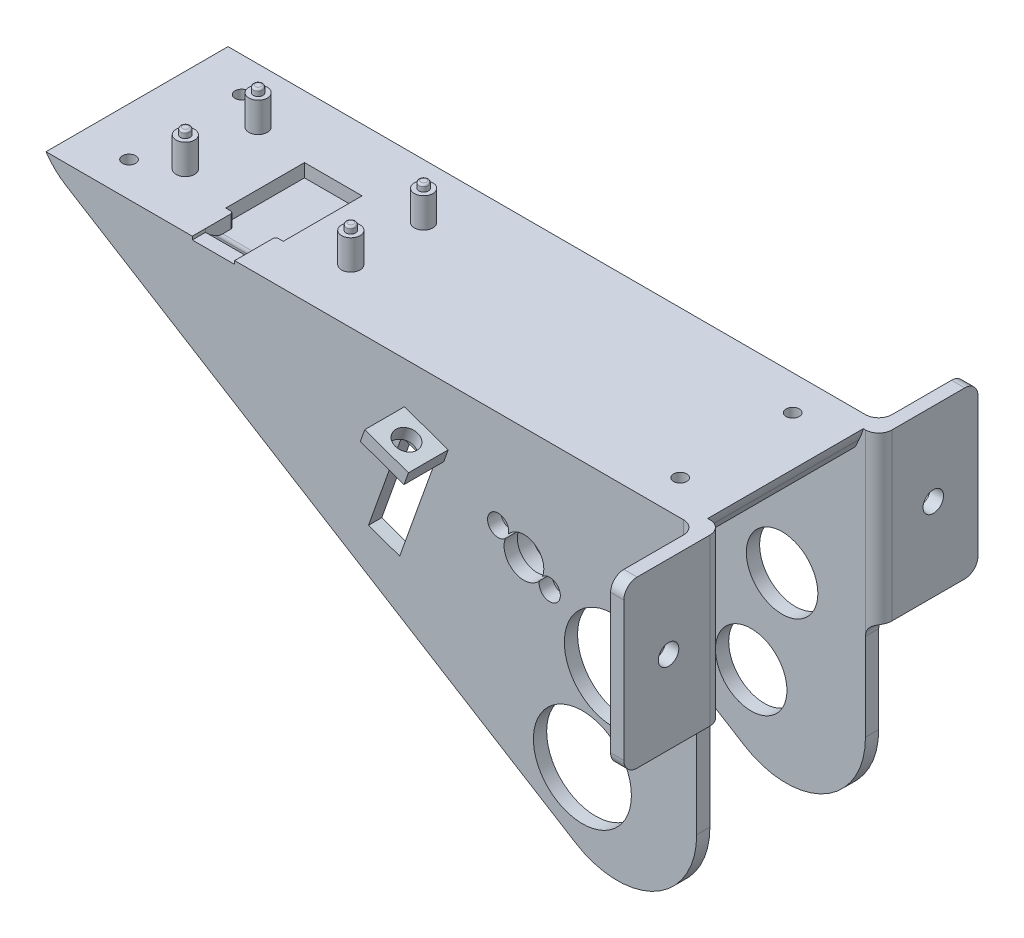
from build123d import *

# Parameters (mm, degrees)
SKETCH_1_W           = 100
SKETCH_1_H           = 25.5
EXTRUDE_1_DEPTH      = 3
EXTRUDE_2_DEPTH      = 1.5
SKETCH_5_R           = 1.4
EXTRUDE_3_DEPTH      = 4.5
SKETCH_6_R           = 0.725
EXTRUDE_4_DEPTH      = 1
SKETCH_7_R           = 1
CUT_EXTRUDE_1_DEPTH  = 10
SKETCH_8_R           = 2
CUT_EXTRUDE_2_DEPTH  = 1
FILLET_1_R           = 2
FILLET_2_R           = 0.3
CUT_EXTRUDE_8_DEPTH  = 2
CUT_EXTRUDE_9_DEPTH  = 1.5
EXTRUDE_6_DEPTH      = 6.4
FILLET_3_R           = 2
FILLET_5_R           = 1
FILLET_6_R           = 0.4
EXTRUDE_12_DEPTH     = 1
CUT_EXTRUDE_20_DEPTH = 27.5
CUT_EXTRUDE_21_DEPTH = 23.5
CUT_EXTRUDE_22_DEPTH = 30
SKETCH_41_R          = 3
CUT_EXTRUDE_25_DEPTH = 50
SKETCH_48_W          = 6.396363923
SKETCH_48_H          = 0.5
CUT_EXTRUDE_30_DEPTH = 5
SKETCH_50_W          = 15
SKETCH_50_H          = 25
SKETCH_50_R          = 1.55
EXTRUDE_14_DEPTH     = 2
FILLET_8_R           = 2
FILLET_9_R           = 2
FILLET_10_R          = 2
SKETCH_52_R          = 3.5
EXTRUDE_15_DEPTH     = 2.5
SKETCH_51_R          = 0.8
CUT_EXTRUDE_31_DEPTH = 4.5
SKETCH_53_R          = 1.6
CUT_EXTRUDE_34_DEPTH = 2
FILLET_11_R          = 1
SKETCH_54_R          = 6.5
CUT_EXTRUDE_35_DEPTH = 2
CUT_EXTRUDE_36_DEPTH = 2
SKETCH_57_R          = 7.4
CUT_EXTRUDE_37_DEPTH = 2
CUT_EXTRUDE_START    = -40.5
CUT_EXTRUDE_38_DEPTH = 53.5
EXTRUDE_16_DEPTH     = 6
SKETCH_61_R          = 1.7
CUT_EXTRUDE_39_DEPTH = 6
SKETCH_62_R          = 5.4
CUT_EXTRUDE_40_DEPTH = 2


with BuildPart() as part:
    # 草图1 → 凸台-拉伸1 (new body)
    with BuildSketch(Plane(origin=(0, 0, 0), x_dir=(1, 0, 0), z_dir=(0, 1, 0))):
        Rectangle(SKETCH_1_W, SKETCH_1_H)
    extrude(amount=EXTRUDE_1_DEPTH)

    # 草图2 → 凸台-拉伸2 (add)
    with BuildSketch(Plane(origin=(0, 3, 0), x_dir=(1, 0, 0), z_dir=(0, 1, 0))):
        Polygon((-5.35, 5.35), (5.35, 5.35), (5.35, -7.55), (4.35, -7.55), (4.35, 4.35), (-4.35, 4.35), (-4.35, -7.55), (-5.35, -7.55), align=None)
    extrude(amount=EXTRUDE_2_DEPTH)

    # 草图5 → 凸台-拉伸3 (add)
    with BuildSketch(Plane(origin=(0, 3, 0), x_dir=(1, 0, 0), z_dir=(0, 1, 0))):
        with Locations(Location((-10.5, 5.5, 0), (0, 0, 270))):
            Circle(SKETCH_5_R)
        with Locations(Location((-10.5, -5.5, 0), (0, 0, 90))):
            Circle(SKETCH_5_R)
        with Locations(Location((-35.5, -5.5, 0), (0, 0, 270))):
            Circle(SKETCH_5_R)
        with Locations(Location((-35.5, 5.5, 0), (0, 0, 90))):
            Circle(SKETCH_5_R)
    extrude(amount=EXTRUDE_3_DEPTH)

    # 草图6 → 凸台-拉伸4 (add)
    with BuildSketch(Plane(origin=(0, 7.5, 0), x_dir=(1, 0, 0), z_dir=(0, 1, 0))):
        with Locations(Location((-35.5, -5.5, 0), (0, 0, 270))):
            Circle(SKETCH_6_R)
        with Locations(Location((-35.5, 5.5, 0), (0, 0, 270))):
            Circle(SKETCH_6_R)
        with Locations(Location((-10.5, 5.5, 0), (0, 0, 270))):
            Circle(SKETCH_6_R)
        with Locations(Location((-10.5, -5.5, 0), (0, 0, 270))):
            Circle(SKETCH_6_R)
    extrude(amount=EXTRUDE_4_DEPTH)

    # 草图7 → 切除-拉伸1 (cut)
    with BuildSketch(Plane(origin=(0, 3, 0), x_dir=(1, 0, 0), z_dir=(0, 1, 0))):
        with Locations(Location((42.25, 8.5, 0), (0, 0, 270))):
            Circle(SKETCH_7_R)
        with Locations(Location((-41, 8.5, 0), (0, 0, 270))):
            Circle(SKETCH_7_R)
        with Locations(Location((-41, -8.5, 0), (0, 0, 270))):
            Circle(SKETCH_7_R)
        with Locations(Location((42.25, -8.5, 0), (0, 0, 270))):
            Circle(SKETCH_7_R)
    extrude(amount=-CUT_EXTRUDE_1_DEPTH, mode=Mode.SUBTRACT)

    # 草图8 → 切除-拉伸2 (cut)
    with BuildSketch(Plane.XZ):
        with Locations(Location((-41, 8.5, 0), (0, 0, 270))):
            Circle(SKETCH_8_R)
        with Locations(Location((42.25, 8.5, 0), (0, 0, 270))):
            Circle(SKETCH_8_R)
        with Locations(Location((42.25, -8.5, 0), (0, 0, 270))):
            Circle(SKETCH_8_R)
        with Locations(Location((-41, -8.5, 0), (0, 0, 270))):
            Circle(SKETCH_8_R)
    extrude(amount=-CUT_EXTRUDE_2_DEPTH, mode=Mode.SUBTRACT)

    # 圆角1
    fillet_1_edges = [part.edges().sort_by_distance(p)[0] for p in [
        (50, 1.5, 12.75),
        (-50, 1.5, 12.75),
        (-50, 1.5, -12.75),
        (50, 1.5, -12.75),
    ]]
    fillet(fillet_1_edges, radius=FILLET_1_R)

    # 圆角2
    fillet_2_edges = [part.edges().sort_by_distance(p)[0] for p in [
        (-35.5, 8.5, 4.775),
        (-35.5, 8.5, -6.225),
        (-10.5, 8.5, -6.225),
        (-10.5, 8.5, 4.775),
    ]]
    fillet(fillet_2_edges, radius=FILLET_2_R)

    # 草图15 → 切除-拉伸8 (cut)
    with BuildSketch(Plane(origin=(0, 3, 0), x_dir=(1, 0, 0), z_dir=(0, 1, 0))):
        Polygon((-27.35, 4.35), (-18.65, 4.35), (-18.65, -7.55), (-19.8, -7.55), (-19.8, -12.75), (-26.2, -12.75), (-26.2, -7.55), (-27.35, -7.55), align=None)
    extrude(amount=-CUT_EXTRUDE_8_DEPTH, mode=Mode.SUBTRACT)

    # 草图17 → 切除-拉伸9 (cut)
    with BuildSketch(Plane(origin=(0, 4.5, 0), x_dir=(1, 0, 0), z_dir=(0, 1, 0))):
        Polygon((-4.35, -7.55), (-4.35, 4.35), (4.35, 4.35), (4.35, -7.55), (5.35, -7.55), (5.35, 5.35), (-5.35, 5.35), (-5.35, -7.55), align=None)
    extrude(amount=-CUT_EXTRUDE_9_DEPTH, mode=Mode.SUBTRACT)

    # 草图18 → 凸台-拉伸6 (add)
    with BuildSketch(Plane.ZY.offset(19.8)):
        Polygon((12.75, 1), (9.75, 1), (12.25, 2.6), (12.75, 2.6), align=None)
    extrude(amount=EXTRUDE_6_DEPTH)

    # 圆角3
    fillet_3_edges = [part.edges().sort_by_distance(p)[0] for p in [
        (-23, 1, 9.75),
    ]]
    fillet(fillet_3_edges, radius=FILLET_3_R)

    # 圆角5
    fillet_5_edges = [part.edges().sort_by_distance(p)[0] for p in [
        (-23, 2.6, 12.25),
    ]]
    fillet(fillet_5_edges, radius=FILLET_5_R)

    # 圆角6
    fillet_6_edges = [part.edges().sort_by_distance(p)[0] for p in [
        (-19.8, 2, 7.55),
        (-26.2, 2, 7.55),
    ]]
    fillet(fillet_6_edges, radius=FILLET_6_R)

    # 草图26 → 凸台-拉伸12 (add, symmetric)
    with BuildSketch(Plane(origin=(0, 0, -12.75), x_dir=(-1, 0, 0), z_dir=(0, 0, -1))):
        Polygon((50, 3), (-47.226468446, -57.009847793), (-50, -58.721719149), (-50, 3), align=None)
    extrude_12 = extrude(amount=EXTRUDE_12_DEPTH, both=True)

    # 镜向1: 凸台-拉伸12 across plane
    add(extrude_12.mirror(Plane.XY))

    # 草图34 → 切除-拉伸20 (cut)
    with BuildSketch(Plane(origin=(0, 0, -13.75), x_dir=(-1, 0, 0), z_dir=(0, 0, -1))):
        with BuildLine():
            Line((50, 15.008699923), (50, 8.579241028))
            ThreePointArc((50, 8.579241028), (48.73277753, 3.707013959), (45.252280679, 0.069626015))
            Line((45.252280679, 0.069626015), (38.344857738, -4.193754173))
            Line((38.344857738, -4.193754173), (52.839499898, -4.765435378))
            Line((52.839499898, -4.765435378), (50, 15.008699923))
        make_face()
    extrude(amount=-CUT_EXTRUDE_20_DEPTH, mode=Mode.SUBTRACT)

    # 草图35 → 切除-拉伸21 (cut)
    with BuildSketch(Plane.XY.offset(-11.75)):
        with BuildLine():
            Line((50, 10.630966152), (50, 5.53970897))
            ThreePointArc((50, 5.53970897), (49.755905436, 3.343733306), (49.035538177, 1.254962787))
            Line((49.035538177, 1.254962787), (33.740658756, -30.998398561))
            Line((33.740658756, -30.998398561), (57.072453739, -23.756268409))
            Line((57.072453739, -23.756268409), (50, 10.630966152))
        make_face()
    extrude(amount=CUT_EXTRUDE_21_DEPTH, mode=Mode.SUBTRACT)

    # 草图37 → 切除-拉伸22 (cut)
    with BuildSketch(Plane(origin=(0, 0, -13.75), x_dir=(-1, 0, 0), z_dir=(0, 0, -1))):
        with BuildLine():
            Line((-50, -58.721719149), (-31.697263185, -47.424955336))
            ThreePointArc((-31.697263185, -47.424955336), (-43.846672482, -47.692750357), (-50, -37.21341732))
            Line((-50, -37.21341732), (-50, -58.721719149))
        make_face()
    extrude(amount=-CUT_EXTRUDE_22_DEPTH, mode=Mode.SUBTRACT)

    # 草图41 → 切除-拉伸25 (cut)
    with BuildSketch(Plane.XY.offset(13.75)):
        with Locations((23.905158818, -13.977647254)):
            Circle(SKETCH_41_R)
    extrude(amount=-CUT_EXTRUDE_25_DEPTH, mode=Mode.SUBTRACT)

    # 草图48 → 切除-拉伸30 (cut)
    with BuildSketch(Plane.XY.offset(13.75)):
        with Locations((-23.000580627, 2.75)):
            Rectangle(SKETCH_48_W, SKETCH_48_H)
    extrude(amount=-CUT_EXTRUDE_30_DEPTH, mode=Mode.SUBTRACT)

    # 草图50 → 凸台-拉伸14 (add)
    # profile 1 of 2: a face of its own
    with BuildSketch(Plane(origin=(50, 0, 0), x_dir=(0, 0, -1), z_dir=(1, 0, 0))):
        with Locations((19.25, -9.5)):
            Rectangle(SKETCH_50_W, SKETCH_50_H)
        with Locations(Location((20, -9.5, 0), (0, 0, 270))):
            Circle(SKETCH_50_R, mode=Mode.SUBTRACT)
    # profile 2 of 2: a face of its own
    with BuildSketch(Plane(origin=(50, 0, 0), x_dir=(0, 0, -1), z_dir=(1, 0, 0))):
        with Locations((-19.25, -9.5)):
            Rectangle(SKETCH_50_W, SKETCH_50_H)
        with Locations(Location((-20, -9.5, 0), (0, 0, 90))):
            Circle(SKETCH_50_R, mode=Mode.SUBTRACT)
    extrude(amount=EXTRUDE_14_DEPTH)

    # 圆角8
    fillet_8_edges = [part.edges().sort_by_distance(p)[0] for p in [
        (50, -9.5, -13.75),
        (50, -9.5, 13.75),
        (51, -22, -26.75),
        (51, 3, -26.75),
        (51, 3, 26.75),
        (51, -22, 26.75),
    ]]
    fillet(fillet_8_edges, radius=FILLET_8_R)

    # 圆角9
    fillet_9_edges = [part.edges().sort_by_distance(p)[0] for p in [
        (50, -22, 12.75),
        (50, -22, -12.75),
    ]]
    fillet(fillet_9_edges, radius=FILLET_9_R - 0.0001)  # a hair under: the kernel refuses the full size

    # 圆角10
    fillet_10_edges = [part.edges().sort_by_distance(p)[0] for p in [
        (52, -9.5, -11.75),
        (52, -9.5, 11.75),
    ]]
    fillet(fillet_10_edges, radius=FILLET_10_R - 0.0001)  # a hair under: the kernel refuses the full size

    # 草图52 → 凸台-拉伸15 (add)
    with BuildSketch(Plane(origin=(0, 0, 11.75), x_dir=(-1, 0, 0), z_dir=(0, 0, -1))):
        Polygon((-21.025993693, -5.964507533), (-32.284323942, -12.464507533), (-26.784323942, -21.990786975), (-15.525993693, -15.490786975), align=None)
        with Locations((-23.905158818, -13.977647254)):
            Circle(SKETCH_52_R, mode=Mode.SUBTRACT)
    extrude(amount=EXTRUDE_15_DEPTH)

    # 草图51 → 切除-拉伸31 (cut)
    with BuildSketch(Plane.XY.offset(13.75)):
        with Locations((20.0080445, -11.727647254)):
            Circle(SKETCH_51_R)
        with Locations((27.802273135, -16.227647254)):
            Circle(SKETCH_51_R)
    extrude(amount=-CUT_EXTRUDE_31_DEPTH, mode=Mode.SUBTRACT)

    # 草图53 → 切除-拉伸34 (cut)
    with BuildSketch(Plane.XY.offset(13.75)):
        with Locations((20.0080445, -11.727647254)):
            Circle(SKETCH_53_R)
        with Locations((27.802273135, -16.227647254)):
            Circle(SKETCH_53_R)
    extrude(amount=-CUT_EXTRUDE_34_DEPTH, mode=Mode.SUBTRACT)

    # 圆角11
    fillet_11_edges = [part.edges().sort_by_distance(p)[0] for p in [
        (29.534323942, -17.227647254, 11.75),
        (21.155158818, -18.740786975, 11.75),
        (18.275993693, -10.727647254, 11.75),
        (26.655158818, -9.214507533, 11.75),
    ]]
    fillet(fillet_11_edges, radius=FILLET_11_R)

    # 草图54 → 切除-拉伸35 (cut)
    with BuildSketch(Plane(origin=(0, 0, -13.75), x_dir=(-1, 0, 0), z_dir=(0, 0, -1))):
        with Locations((-23.905158818, -13.977647254)):
            Circle(SKETCH_54_R)
    extrude(amount=-CUT_EXTRUDE_35_DEPTH, mode=Mode.SUBTRACT)

    # 草图55 → 切除-拉伸36 (cut)
    with BuildSketch(Plane(origin=(0, 0, -13.75), x_dir=(-1, 0, 0), z_dir=(0, 0, -1))):
        Polygon((-21.025993693, -5.964507533), (-15.525993693, -15.490786975), (-26.784323942, -21.990786975), (-32.284323942, -12.464507533), align=None)
    extrude(amount=-CUT_EXTRUDE_36_DEPTH, mode=Mode.SUBTRACT)

    # 草图57 → 切除-拉伸37 (cut)
    with BuildSketch(Plane.XY.offset(13.75)):
        with Locations((37.405158818, -22.012203869)):
            Circle(SKETCH_57_R)
        with Locations((32.735672764, -37.012203869)):
            Circle(SKETCH_57_R)
    extrude(amount=-CUT_EXTRUDE_37_DEPTH, mode=Mode.SUBTRACT)

    # 草图58 → 切除-拉伸38 (cut)
    with BuildSketch(Plane.XY.offset(13.75).offset(CUT_EXTRUDE_START)):
        Polygon((6.8140956, -18.485032606), (10.170964352, -9.065296294), (5.461096196, -7.386861918), (2.104227444, -16.80659823), (0.425793068, -21.516466385), (5.135661224, -23.194900761), align=None)
    extrude(amount=CUT_EXTRUDE_38_DEPTH, mode=Mode.SUBTRACT)

    # 草图59 → 凸台-拉伸16 (add)
    with BuildSketch(Plane.XY.offset(13.75)):
        Polygon((5.190496315, -5.16722778), (11.784311734, -7.517035907), (12.455685484, -5.633088644), (5.861870066, -3.283280518), align=None)
    extrude_16 = extrude(amount=EXTRUDE_16_DEPTH)

    # 草图61 → 切除-拉伸39 (cut)
    with BuildSketch(Plane(origin=(-0.377651369, -1.059730533, 0), x_dir=(0.9419736311729069, -0.3356868751901519, 0), z_dir=(0.3356868751901519, 0.9419736311729069, 0))):
        with Locations(Location((10.123881209, -16.75, 0), (0, 0, 180))):
            Circle(SKETCH_61_R)
    cut_extrude_39 = extrude(amount=-CUT_EXTRUDE_39_DEPTH, mode=Mode.SUBTRACT)

    # 草图62 → 切除-拉伸40 (cut)
    with BuildSketch(Plane(origin=(0, 0, -13.75), x_dir=(-1, 0, 0), z_dir=(0, 0, -1))):
        with Locations((-37.405158818, -22.012203869)):
            Circle(SKETCH_62_R)
        with Locations((-32.735672764, -37.012203869)):
            Circle(SKETCH_62_R)
    extrude(amount=-CUT_EXTRUDE_40_DEPTH, mode=Mode.SUBTRACT)

    # 镜向2: 凸台-拉伸16, 切除-拉伸39 across plane
    add(extrude_16.mirror(Plane.XY))
    add(cut_extrude_39.mirror(Plane.XY), mode=Mode.SUBTRACT)


solid = part.part
